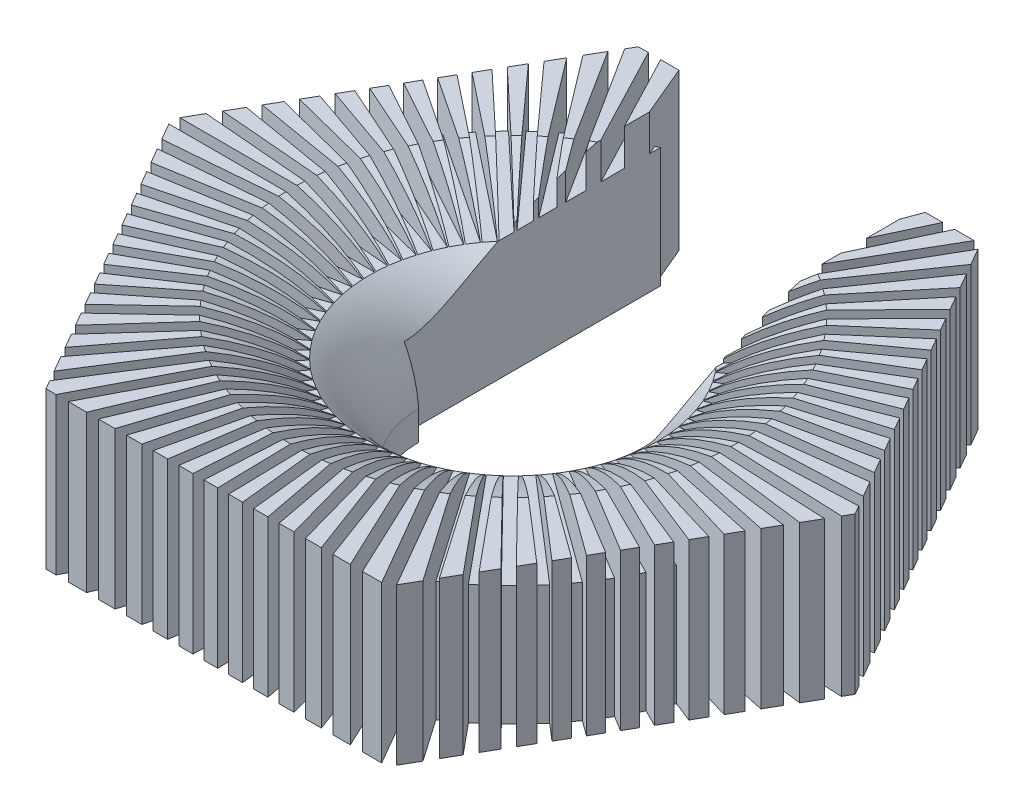
from build123d import *

# Parameters (mm, degrees)
BOSS_EXTRUDE2_DEPTH = 77.5
SKETCH6_R           = 13
CUT_EXTRUDE1_DEPTH  = 77.5
CUT_EXTRUDE2_DEPTH  = 0.75
CIRPATTERN1_COUNT   = 75
SKETCH9_OUTSIDE_W   = 166.142
SKETCH9_OUTSIDE_H   = 154.554
CUT_EXTRUDE3_DEPTH  = 67
SKETCH11_W          = 30
SKETCH11_H          = 62.142692489
CUT_EXTRUDE6_DEPTH  = 116.410358453
SKETCH13_W          = 162.255031816
SKETCH13_H          = 137.877383394
CUT_EXTRUDE7_DEPTH  = 56


with BuildPart() as part:
    # Sketch1 → Boss-Extrude2 (new body)
    with BuildSketch(Plane(origin=(0, 0, 0), x_dir=(1, 0, 0), z_dir=(0, 1, 0))):
        with BuildLine():
            Line((60.621778265, 10), (38.97114317, 47.5))
            ThreePointArc((38.97114317, 47.5), (31.650635095, 54.820508076), (21.650635095, 57.5))
            Line((21.650635095, 57.5), (-21.650635095, 57.5))
            ThreePointArc((-21.650635095, 57.5), (-31.650635095, 54.820508076), (-38.97114317, 47.5))
            Line((-38.97114317, 47.5), (-60.621778265, 10))
            ThreePointArc((-60.621778265, 10), (-63.301270189, 0), (-60.621778265, -10))
            Line((-60.621778265, -10), (-38.97114317, -47.5))
            ThreePointArc((-38.97114317, -47.5), (-31.650635095, -54.820508076), (-21.650635095, -57.5))
            Line((-21.650635095, -57.5), (21.650635095, -57.5))
            ThreePointArc((21.650635095, -57.5), (31.650635095, -54.820508076), (38.97114317, -47.5))
            Line((38.97114317, -47.5), (60.621778265, -10))
            ThreePointArc((60.621778265, -10), (63.301270189, 0), (60.621778265, 10))
        make_face()
    extrude(amount=BOSS_EXTRUDE2_DEPTH)

    # Sketch6 → Cut-Extrude1 (cut)
    with BuildSketch(Plane(origin=(0, 77.5, 0), x_dir=(1, 0, 0), z_dir=(0, 1, 0))):
        with Locations(Location((0, 0, 0), (0, 0, 270))):
            Circle(SKETCH6_R)
    extrude(amount=-CUT_EXTRUDE1_DEPTH, mode=Mode.SUBTRACT)

    # Sketch7 → Cut-Revolve1 (revolve, cut)
    with BuildSketch(Plane.XY, mode=Mode.PRIVATE) as cut_revolve1_sk:
        with BuildLine():
            Line((13, 77.5), (13, 60))
            add(Edge.make_bspline(
                [(13, 60), (14.00368376, 72.891944156), (30.5, 77.5)],
                knots=[0, 0, 0, 1, 1, 1], degree=2))
            Line((30.5, 77.5), (13, 77.5))
        make_face()
        with BuildLine():
            Line((64.942286341, 77.5), (47.442286341, 77.5))
            add(Edge.make_bspline(
                [(64.942286341, 60), (63.93860258, 72.891944156), (47.442286341, 77.5)],
                knots=[0, 0, 0, 1, 1, 1], degree=2))
            Line((64.942286341, 60), (64.942286341, 77.5))
        make_face()
    revolve(cut_revolve1_sk.sketch.rotate(Axis((0, 77.5, 0), (0, -1, 0)), 90), axis=Axis((0, 77.5, 0), (0, -1, 0)), mode=Mode.SUBTRACT)

    # Sketch8 → Cut-Extrude2 (cut, symmetric)
    with BuildSketch(Plane.XY):
        Polygon((-63.301270189, 77.5), (-63.301270189, 0), (-38.301270189, 0), (-38.301270189, 5), (-38.301270189, 72.5), (-13.301270189, 72.5), (-13.301270189, 77.5), align=None)
    cut_extrude2 = extrude(amount=CUT_EXTRUDE2_DEPTH, both=True, mode=Mode.SUBTRACT)

    # CirPattern1: Cut-Extrude2 ×75 about axis
    cirpattern1_axis = Axis((0, 0, 0), (0, 1, 0))
    for i in range(1, CIRPATTERN1_COUNT):
        add(cut_extrude2.rotate(cirpattern1_axis, i * 360 / CIRPATTERN1_COUNT), mode=Mode.SUBTRACT)

    # Sketch9 outside → Cut-Extrude3 (cut)
    with BuildSketch(Plane(origin=(0, 77.5, 0), x_dir=(1, 0, 0), z_dir=(0, 1, 0))):
        with Locations((0.007, 0)):
            Rectangle(SKETCH9_OUTSIDE_W, SKETCH9_OUTSIDE_H)
        Polygon((47.054046939, 0), (23.527023469, 40.75), (-23.527023469, 40.75), (-47.054046939, 0), (-23.527023469, -40.75), (23.527023469, -40.75), align=None, mode=Mode.SUBTRACT)
    extrude(amount=-CUT_EXTRUDE3_DEPTH, mode=Mode.SUBTRACT)

    # Sketch11 → Cut-Extrude6 (cut, through all)
    with BuildSketch(Plane.XZ):
        with Locations((0, -31.071346245)):
            Rectangle(SKETCH11_W, SKETCH11_H)
    extrude(amount=-CUT_EXTRUDE6_DEPTH, mode=Mode.SUBTRACT)


with BuildPart() as cut_extrude6_kept_piece:
    # of the separate pieces the step leaves, the one the design keeps (cut_extrude6_pieces_kept)
    add(part.part.solids().sort_by_distance((-21.650635095, 0, 57.5))[0])

    # Sketch13 → Cut-Extrude7 (cut)
    with BuildSketch(Plane.XZ):
        Rectangle(SKETCH13_W, SKETCH13_H)
    extrude(amount=-CUT_EXTRUDE7_DEPTH, mode=Mode.SUBTRACT)


solid = cut_extrude6_kept_piece.part
